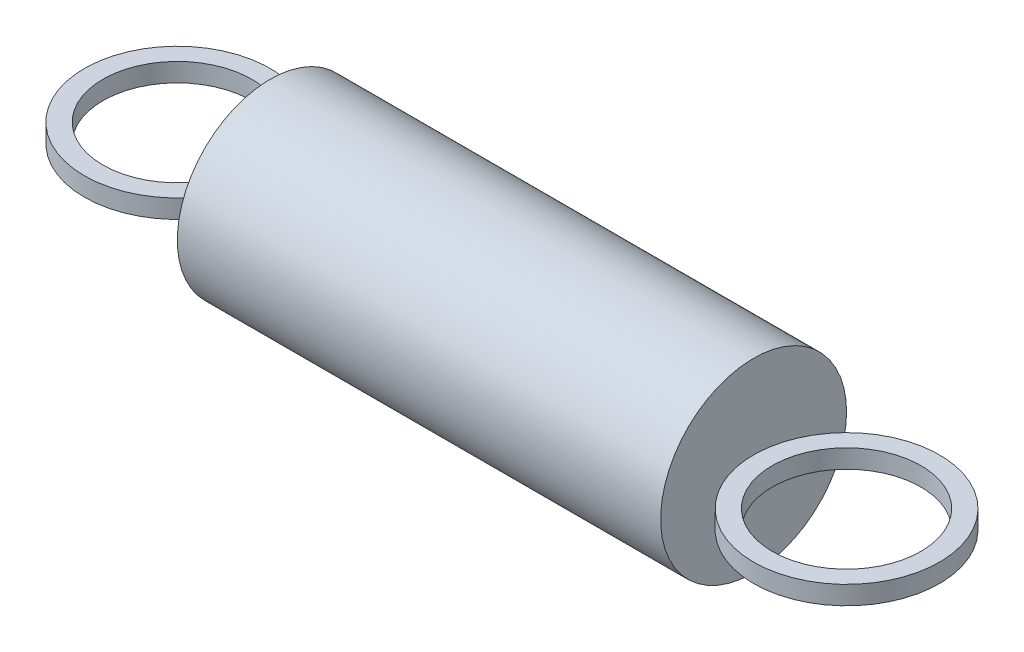
from build123d import *

# Parameters (mm, degrees)
SKETCH1_R             = 3.96875
BOSS_EXTRUDE1_DEPTH   = 20.6375
SKETCH3_R             = 3.96875
SKETCH3_R_2           = 3.175
BOSS_EXTRUDE2_DEPTH   = 0.396875
BOSS_EXTRUDE2_2_DEPTH = 0.396875


with BuildPart() as part:
    # Sketch1 → Boss-Extrude1 (new body)
    with BuildSketch(Plane(origin=(0, 0, 0), x_dir=(0, 0, -1), z_dir=(1, 0, 0))):
        Circle(SKETCH1_R)
    extrude(amount=BOSS_EXTRUDE1_DEPTH)


with BuildPart() as body_2:
    # Sketch3 → Boss-Extrude2 (new, symmetric)
    with BuildSketch(Plane(origin=(0, 0, 0), x_dir=(1, 0, 0), z_dir=(0, 1, 0))):
        with Locations((-3.96875, 0)):
            Circle(SKETCH3_R)
        with Locations((-3.96875, 0)):
            Circle(SKETCH3_R_2, mode=Mode.SUBTRACT)
    extrude(amount=BOSS_EXTRUDE2_DEPTH, both=True)


with BuildPart() as body_3:
    # Sketch3 → Boss-Extrude2 2 (new, symmetric)
    with BuildSketch(Plane(origin=(0, 0, 0), x_dir=(1, 0, 0), z_dir=(0, 1, 0))):
        with Locations((24.60625, 0)):
            Circle(SKETCH3_R)
        with Locations((24.60625, 0)):
            Circle(SKETCH3_R_2, mode=Mode.SUBTRACT)
    extrude(amount=BOSS_EXTRUDE2_2_DEPTH, both=True)


solid = Compound([part.part, body_2.part, body_3.part])
